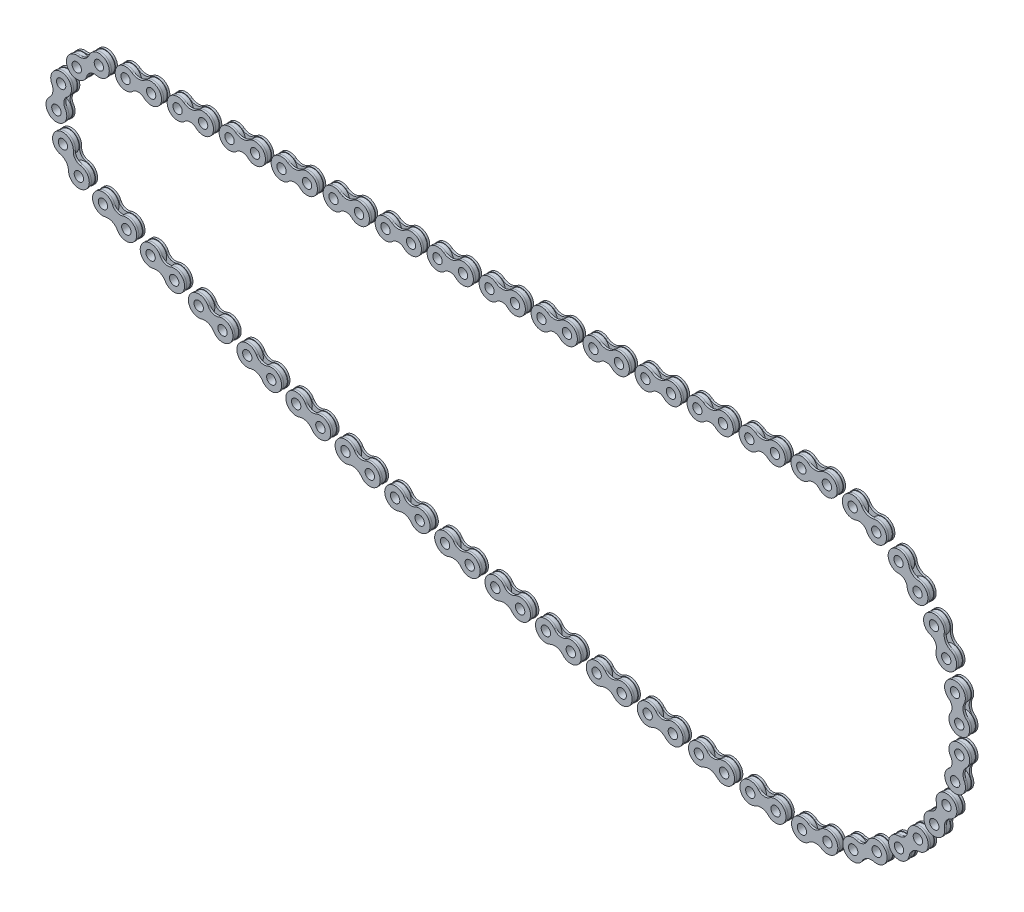
from build123d import *

# Parameters (mm, degrees)
SKETCH1_R             = 4.75
SKETCH1_R_2           = 2.25
BOSS_EXTRUDE1_DEPTH   = 1
BOSS_EXTRUDE1_2_DEPTH = 1
SKETCH3_R             = 2.25
BOSS_EXTRUDE2_DEPTH   = 1
CRVPATTERN1_5_ANGLE   = 3.8901012
CRVPATTERN1_6_ANGLE   = 23.0027709
CRVPATTERN1_7_ANGLE   = 42.1154406
CRVPATTERN1_8_ANGLE   = 61.2281103
CRVPATTERN1_9_ANGLE   = 80.34078
CRVPATTERN1_10_ANGLE  = 99.4534497
CRVPATTERN1_11_ANGLE  = 118.5661194
CRVPATTERN1_12_ANGLE  = 137.6787891
CRVPATTERN1_13_ANGLE  = 156.7914588
CRVPATTERN1_14_ANGLE  = 175.9041285
CRVPATTERN1_15_ANGLE  = 172.3357403
CRVPATTERN1_16_ANGLE  = 171.095109
CRVPATTERN1_17_ANGLE  = 169.8544777
CRVPATTERN1_18_ANGLE  = 168.6138464
CRVPATTERN1_19_ANGLE  = 167.3732151
CRVPATTERN1_20_ANGLE  = 166.1325838
CRVPATTERN1_21_ANGLE  = 164.8919525
CRVPATTERN1_22_ANGLE  = 163.6513212
CRVPATTERN1_23_ANGLE  = 162.4106898
CRVPATTERN1_24_ANGLE  = 161.1700585
CRVPATTERN1_25_ANGLE  = 159.9294272
CRVPATTERN1_26_ANGLE  = 158.6887959
CRVPATTERN1_27_ANGLE  = 157.4481646
CRVPATTERN1_28_ANGLE  = 156.2075333
CRVPATTERN1_29_ANGLE  = 128.6116148
CRVPATTERN1_30_ANGLE  = 79.3521569
CRVPATTERN1_31_ANGLE  = 30.0926989


with BuildPart() as part:
    # Sketch1 → Boss-Extrude1 (new, symmetric)
    with BuildSketch(Plane.XY):
        with Locations((-6.15, 0)):
            Circle(SKETCH1_R)
        with Locations((-6.15, 0)):
            Circle(SKETCH1_R_2, mode=Mode.SUBTRACT)
    extrude(amount=BOSS_EXTRUDE1_DEPTH, both=True)



with BuildPart() as body_2:
    # Sketch1 → Boss-Extrude1 2 (new, symmetric)
    with BuildSketch(Plane.XY):
        with Locations(Location((6.15, 0, 0), (0, 0, 180))):
            Circle(SKETCH1_R)
        with Locations((6.15, 0)):
            Circle(SKETCH1_R_2, mode=Mode.SUBTRACT)
    extrude(amount=BOSS_EXTRUDE1_2_DEPTH, both=True)


with BuildPart() as part_1:
    add(part.part)

    add(body_2.part)  # Boss-Extrude2 merges body 2
    # Sketch3 → Boss-Extrude2 (add)
    with BuildSketch(Plane.XY.offset(1)):
        with BuildLine():
            ThreePointArc((-3.114654673, 3.973245367), (-11.143454791, -0.255752327), (-2.724603229, -3.642342235))
            ThreePointArc((-2.724603229, -3.642342235), (0, -2.56244435), (2.724603229, -3.642342235))
            ThreePointArc((2.724603229, -3.642342235), (11.143454791, -0.255752327), (3.114654673, 3.973245367))
            ThreePointArc((3.114654673, 3.973245367), (0, 2.919663065), (-3.114654673, 3.973245367))
        make_face()
        with Locations((6.15, 0)):
            Circle(SKETCH3_R, mode=Mode.SUBTRACT)
        with Locations((-6.15, 0)):
            Circle(SKETCH3_R, mode=Mode.SUBTRACT)
    extrude(amount=BOSS_EXTRUDE2_DEPTH)

    # Mirror1: part across plane


with BuildPart() as part_2:
    add(part_1.part)
    add(part_1.part.mirror(Plane.XY))


with BuildPart() as body_2_2:
    # CrvPattern1: read off the stored shape, not the designer's step
    # CrvPattern1: copy of part
    add(part_2.part.moved(Location((25.0184261, 0, 0))))


with BuildPart() as body_3:
    # CrvPattern1 2: copy of part
    add(part_2.part.moved(Location((50.0368522, 0, 0))))


with BuildPart() as body_4:
    # CrvPattern1 3: copy of part
    add(part_2.part.moved(Location((75.0552784, 0, 0))))


with BuildPart() as body_5:
    # CrvPattern1 4: copy of part
    add(part_2.part.moved(Location((100.0737045, 0, 0))))


with BuildPart() as body_6:
    # CrvPattern1 5: copy of part
    add(part_2.part.moved(Location((124.8099335, 8.3138884, 0))).rotate(Axis((0, 0, 0), (0, 0, -1)), CRVPATTERN1_5_ANGLE))


with BuildPart() as body_7:
    # CrvPattern1 6: copy of part
    add(part_2.part.moved(Location((139.7560766, 52.8545123, 0))).rotate(Axis((0, 0, 0), (0, 0, -1)), CRVPATTERN1_6_ANGLE))


with BuildPart() as body_8:
    # CrvPattern1 7: copy of part
    add(part_2.part.moved(Location((139.2945405, 99.833671, 0))).rotate(Axis((0, 0, 0), (0, 0, -1)), CRVPATTERN1_7_ANGLE))


with BuildPart() as body_9:
    # CrvPattern1 8: copy of part
    add(part_2.part.moved(Location((123.4762081, 144.0720562, 0))).rotate(Axis((0, 0, 0), (0, 0, -1)), CRVPATTERN1_8_ANGLE))


with BuildPart() as body_10:
    # CrvPattern1 9: copy of part
    add(part_2.part.moved(Location((94.0450021, 180.6925216, 0))).rotate(Axis((0, 0, 0), (0, 0, -1)), CRVPATTERN1_9_ANGLE))


with BuildPart() as body_11:
    # CrvPattern1 10: copy of part
    add(part_2.part.moved(Location((54.2456228, 205.657773, 0))).rotate(Axis((0, 0, 0), (0, 0, -1)), CRVPATTERN1_10_ANGLE))


with BuildPart() as body_12:
    # CrvPattern1 11: copy of part
    add(part_2.part.moved(Location((8.4658298, 216.2154679, 0))).rotate(Axis((0, 0, 0), (0, 0, -1)), CRVPATTERN1_11_ANGLE))


with BuildPart() as body_13:
    # CrvPattern1 12: copy of part
    add(part_2.part.moved(Location((-38.247295, 211.2016529, 0))).rotate(Axis((0, 0, 0), (0, 0, -1)), CRVPATTERN1_12_ANGLE))


with BuildPart() as body_14:
    # CrvPattern1 13: copy of part
    add(part_2.part.moved(Location((-80.7437727, 191.1690856, 0))).rotate(Axis((0, 0, 0), (0, 0, -1)), CRVPATTERN1_13_ANGLE))


with BuildPart() as body_15:
    # CrvPattern1 14: copy of part
    add(part_2.part.moved(Location((-114.3384969, 158.3262953, 0))).rotate(Axis((0, 0, 0), (0, 0, -1)), CRVPATTERN1_14_ANGLE))


with BuildPart() as body_16:
    # CrvPattern1 15: copy of part
    add(part_2.part.moved(Location((-119.3027137, 133.3156531, 0))).rotate(Axis((0, 0, 0), (0, 0, 1)), CRVPATTERN1_15_ANGLE))


with BuildPart() as body_17:
    # CrvPattern1 16: copy of part
    add(part_2.part.moved(Location((-97.1453243, 130.9721759, 0))).rotate(Axis((0, 0, 0), (0, 0, 1)), CRVPATTERN1_16_ANGLE))


with BuildPart() as body_18:
    # CrvPattern1 17: copy of part
    add(part_2.part.moved(Location((-74.9423894, 129.1089868, 0))).rotate(Axis((0, 0, 0), (0, 0, 1)), CRVPATTERN1_17_ANGLE))


with BuildPart() as body_19:
    # CrvPattern1 18: copy of part
    add(part_2.part.moved(Location((-52.7043187, 127.7269593, 0))).rotate(Axis((0, 0, 0), (0, 0, 1)), CRVPATTERN1_18_ANGLE))


with BuildPart() as body_20:
    # CrvPattern1 19: copy of part
    add(part_2.part.moved(Location((-30.4415381, 126.8267413, 0))).rotate(Axis((0, 0, 0), (0, 0, 1)), CRVPATTERN1_19_ANGLE))


with BuildPart() as body_21:
    # CrvPattern1 20: copy of part
    add(part_2.part.moved(Location((-8.1644854, 126.4087549, 0))).rotate(Axis((0, 0, 0), (0, 0, 1)), CRVPATTERN1_20_ANGLE))


with BuildPart() as body_22:
    # CrvPattern1 21: copy of part
    add(part_2.part.moved(Location((14.1163951, 126.473196, 0))).rotate(Axis((0, 0, 0), (0, 0, 1)), CRVPATTERN1_21_ANGLE))


with BuildPart() as body_23:
    # CrvPattern1 22: copy of part
    add(part_2.part.moved(Location((36.3906573, 127.0200346, 0))).rotate(Axis((0, 0, 0), (0, 0, 1)), CRVPATTERN1_22_ANGLE))


with BuildPart() as body_24:
    # CrvPattern1 23: copy of part
    add(part_2.part.moved(Location((58.6478582, 128.0490141, 0))).rotate(Axis((0, 0, 0), (0, 0, 1)), CRVPATTERN1_23_ANGLE))


with BuildPart() as body_25:
    # CrvPattern1 24: copy of part
    add(part_2.part.moved(Location((80.8775627, 129.5596521, 0))).rotate(Axis((0, 0, 0), (0, 0, 1)), CRVPATTERN1_24_ANGLE))


with BuildPart() as body_26:
    # CrvPattern1 25: copy of part
    add(part_2.part.moved(Location((103.0693487, 131.5512405, 0))).rotate(Axis((0, 0, 0), (0, 0, 1)), CRVPATTERN1_25_ANGLE))


with BuildPart() as body_27:
    # CrvPattern1 26: copy of part
    add(part_2.part.moved(Location((125.2128119, 134.0228454, 0))).rotate(Axis((0, 0, 0), (0, 0, 1)), CRVPATTERN1_26_ANGLE))


with BuildPart() as body_28:
    # CrvPattern1 27: copy of part
    add(part_2.part.moved(Location((147.2975704, 136.9733081, 0))).rotate(Axis((0, 0, 0), (0, 0, 1)), CRVPATTERN1_27_ANGLE))


with BuildPart() as body_29:
    # CrvPattern1 28: copy of part
    add(part_2.part.moved(Location((169.3132702, 140.4012453, 0))).rotate(Axis((0, 0, 0), (0, 0, 1)), CRVPATTERN1_28_ANGLE))


with BuildPart() as body_30:
    # CrvPattern1 29: copy of part
    add(part_2.part.moved(Location((108.2566184, 211.2167923, 0))).rotate(Axis((0, 0, 0), (0, 0, 1)), CRVPATTERN1_29_ANGLE))


with BuildPart() as body_31:
    # CrvPattern1 30: copy of part
    add(part_2.part.moved(Location((-67.3530888, 229.9695687, 0))).rotate(Axis((0, 0, 0), (0, 0, 1)), CRVPATTERN1_30_ANGLE))


with BuildPart() as body_32:
    # CrvPattern1 31: copy of part
    add(part_2.part.moved(Location((-196.1705429, 109.1535954, 0))).rotate(Axis((0, 0, 0), (0, 0, 1)), CRVPATTERN1_31_ANGLE))


with BuildPart() as body_33:
    # CrvPattern1 32: copy of part
    add(part_2.part.moved(Location((-200.147409, 0, 0))))


with BuildPart() as body_34:
    # CrvPattern1 33: copy of part
    add(part_2.part.moved(Location((-175.1289829, 0, 0))))


with BuildPart() as body_35:
    # CrvPattern1 34: copy of part
    add(part_2.part.moved(Location((-150.1105567, 0, 0))))


with BuildPart() as body_36:
    # CrvPattern1 35: copy of part
    add(part_2.part.moved(Location((-125.0921306, 0, 0))))


with BuildPart() as body_37:
    # CrvPattern1 36: copy of part
    add(part_2.part.moved(Location((-100.0737045, 0, 0))))


with BuildPart() as body_38:
    # CrvPattern1 37: copy of part
    add(part_2.part.moved(Location((-75.0552784, 0, 0))))


with BuildPart() as body_39:
    # CrvPattern1 38: copy of part
    add(part_2.part.moved(Location((-50.0368522, 0, 0))))


with BuildPart() as body_40:
    # CrvPattern1 39: copy of part
    add(part_2.part.moved(Location((-25.0184261, 0, 0))))


solid = Compound([part_2.part, body_2_2.part, body_3.part, body_4.part, body_5.part, body_6.part, body_7.part, body_8.part, body_9.part, body_10.part, body_11.part, body_12.part, body_13.part, body_14.part, body_15.part, body_16.part, body_17.part, body_18.part, body_19.part, body_20.part, body_21.part, body_22.part, body_23.part, body_24.part, body_25.part, body_26.part, body_27.part, body_28.part, body_29.part, body_30.part, body_31.part, body_32.part, body_33.part, body_34.part, body_35.part, body_36.part, body_37.part, body_38.part, body_39.part, body_40.part])
